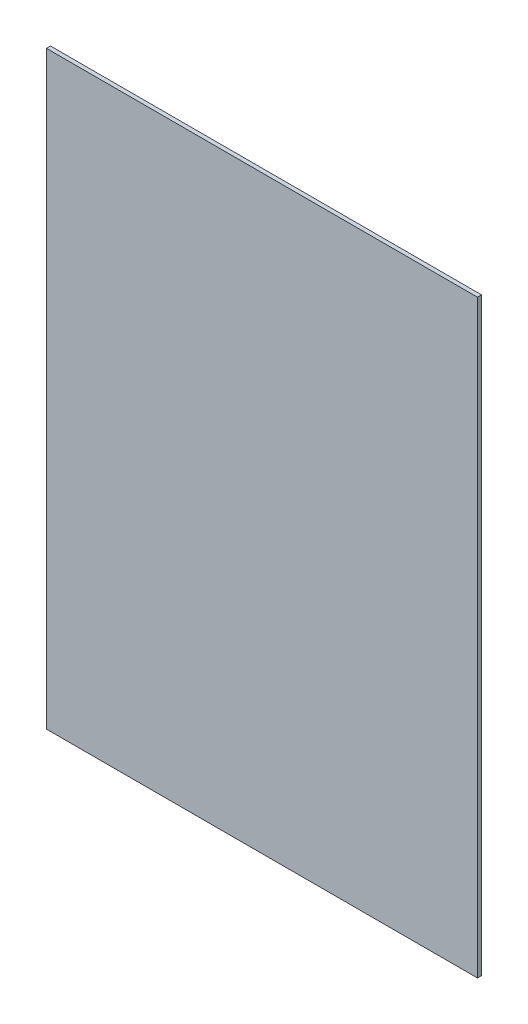
from build123d import *

# Parameters (mm, degrees)
SKETCH1_W           = 212
SKETCH1_H           = 290
BOSS_EXTRUDE1_DEPTH = 2


with BuildPart() as part:
    # Sketch1 → Boss-Extrude1 (new body)
    with BuildSketch(Plane.XY):
        Rectangle(SKETCH1_W, SKETCH1_H)
    extrude(amount=BOSS_EXTRUDE1_DEPTH)


solid = part.part
